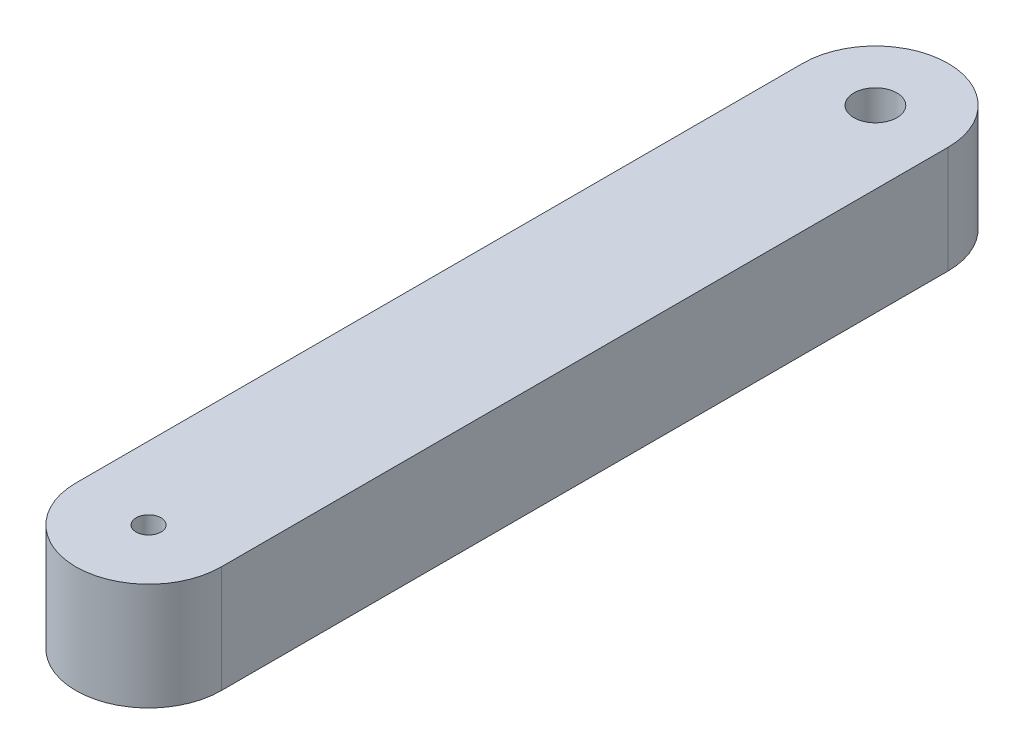
from build123d import *

# Parameters (mm, degrees)
SKETCH1_R           = 2.05
BOSS_EXTRUDE1_DEPTH = 17.7
SKETCH2_R           = 3.55
CUT_EXTRUDE1_DEPTH  = 6


with BuildPart() as part:
    # Sketch1 → Boss-Extrude1 (new body)
    with BuildSketch(Plane(origin=(0, 0, 0), x_dir=(1, 0, 0), z_dir=(0, 1, 0))):
        with BuildLine():
            Line((-12, -60), (-12, 60))
            ThreePointArc((-12, 60), (0, 72), (12, 60))
            Line((12, 60), (12, -60))
            ThreePointArc((12, -60), (0, -72), (-12, -60))
        make_face()
        with Locations((0, 60)):
            Circle(SKETCH1_R, mode=Mode.SUBTRACT)
        with Locations((0, -60)):
            Circle(SKETCH1_R, mode=Mode.SUBTRACT)
    extrude(amount=BOSS_EXTRUDE1_DEPTH)

    # Sketch2 → Cut-Extrude1 (cut)
    with BuildSketch(Plane(origin=(0, 17.7, 0), x_dir=(1, 0, 0), z_dir=(0, 1, 0))):
        with Locations((0, 60)):
            Circle(SKETCH2_R)
    extrude(amount=-CUT_EXTRUDE1_DEPTH, mode=Mode.SUBTRACT)


solid = part.part
